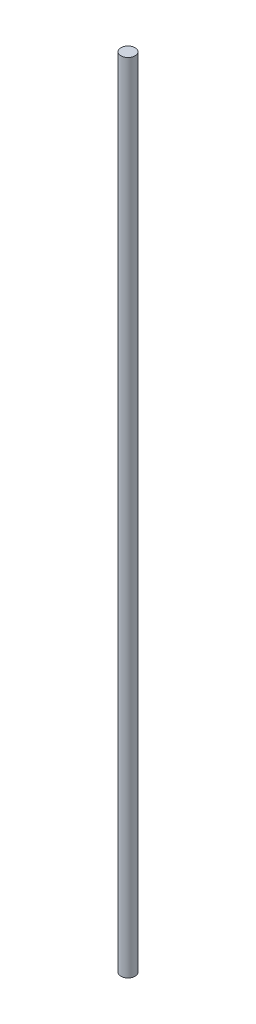
from build123d import *

# Parameters (mm, degrees)
SKETCH1_R           = 1.5
BOSS_EXTRUDE1_DEPTH = 170


with BuildPart() as part:
    # Sketch1 → Boss-Extrude1 (new body)
    with BuildSketch(Plane(origin=(0, 0, 0), x_dir=(1, 0, 0), z_dir=(0, 1, 0))):
        Circle(SKETCH1_R)
    extrude(amount=BOSS_EXTRUDE1_DEPTH)


solid = part.part
